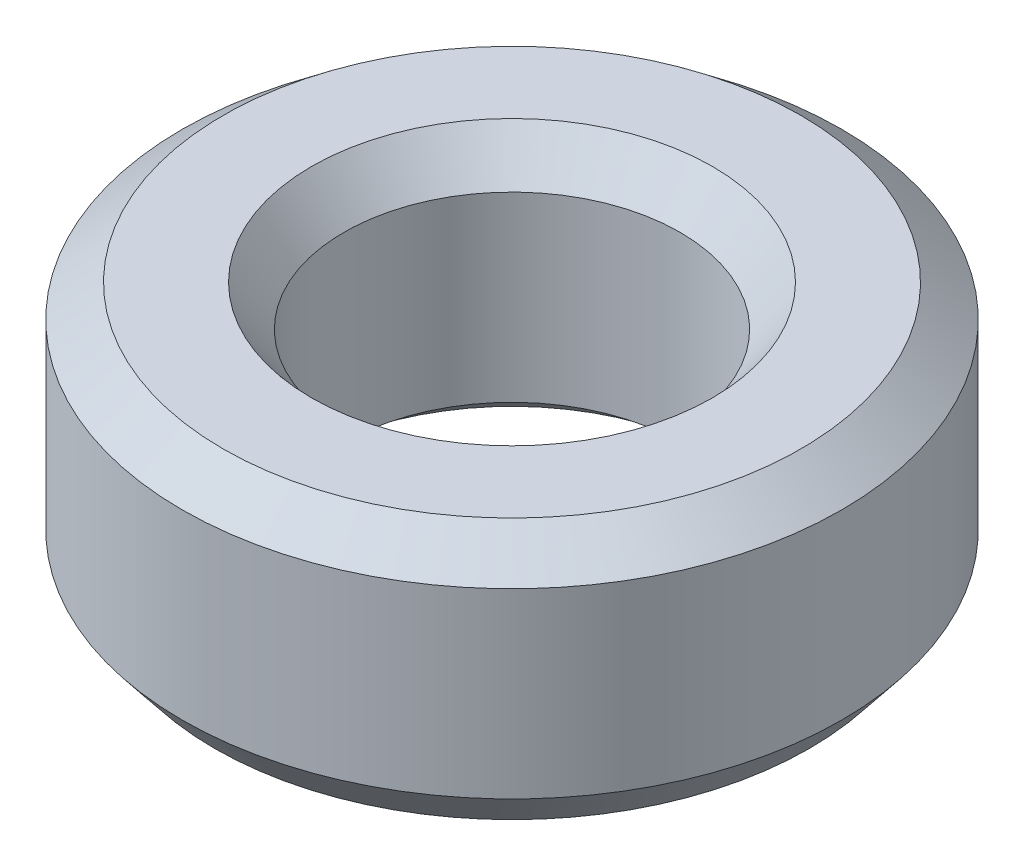
from build123d import *
from OCP.BRepFilletAPI import BRepFilletAPI_MakeChamfer

# Parameters (mm, degrees)
SKETCH1_R           = 35
BOSS_EXTRUDE1_DEPTH = 27.098370387
SKETCH2_R           = 17.840820631
CUT_EXTRUDE1_DEPTH  = 57.429794237
CHAMFER1_SIZE       = 3.438708375
CHAMFER1_SIZE2      = 4.333782867


with BuildPart() as part:
    # Sketch1 → Boss-Extrude1 (new body)
    with BuildSketch(Plane(origin=(0, 0, 0), x_dir=(1, 0, 0), z_dir=(0, 1, 0))):
        Circle(SKETCH1_R)
    extrude(amount=BOSS_EXTRUDE1_DEPTH)

    # Sketch2 → Cut-Extrude1 (cut, through all)
    with BuildSketch(Plane(origin=(0, 0, 0), x_dir=(1, 0, 0), z_dir=(0, 1, 0))):
        Circle(SKETCH2_R)
    extrude(amount=CUT_EXTRUDE1_DEPTH, mode=Mode.SUBTRACT)

    # Chamfer1: one chamfer whose edges measure the first distance from different faces: ONE call of the kernel's chamfer builder (chamfer() names one face for all edges)
    chamfer1_edges_1 = [part.edges().sort_by_distance(p)[0] for p in [
        (-17.840820631, 27.098370387, 0),
    ]]
    chamfer1_side_1 = [part.faces().sort_by_distance(p)[0] for p in [
        (-34.010050506, 27.098370387, 0),
    ]]
    chamfer1_edges_2 = [part.edges().sort_by_distance(p)[0] for p in [
        (-17.840820631, 0, 0),
    ]]
    chamfer1_side_2 = [part.faces().sort_by_distance(p)[0] for p in [
        (-17.840820631, 13.549185194, 0),
    ]]
    chamfer1_edges_3 = [part.edges().sort_by_distance(p)[0] for p in [
        (-35, 0, 0),
    ]]
    chamfer1_side_3 = [part.faces().sort_by_distance(p)[0] for p in [
        (-34.010050506, 0, 0),
    ]]
    chamfer1_edges_4 = [part.edges().sort_by_distance(p)[0] for p in [
        (-35, 27.098370387, 0),
    ]]
    chamfer1_side_4 = [part.faces().sort_by_distance(p)[0] for p in [
        (-35, 13.549185194, 0),
    ]]
    chamfer1 = BRepFilletAPI_MakeChamfer(part.part.solid().wrapped)
    for e in chamfer1_edges_1:
        chamfer1.Add(CHAMFER1_SIZE, CHAMFER1_SIZE2, e.wrapped, chamfer1_side_1[0].wrapped)  # the first distance lies on this face
    for e in chamfer1_edges_2:
        chamfer1.Add(CHAMFER1_SIZE, CHAMFER1_SIZE2, e.wrapped, chamfer1_side_2[0].wrapped)  # the first distance lies on this face
    for e in chamfer1_edges_3:
        chamfer1.Add(CHAMFER1_SIZE, CHAMFER1_SIZE2, e.wrapped, chamfer1_side_3[0].wrapped)  # the first distance lies on this face
    for e in chamfer1_edges_4:
        chamfer1.Add(CHAMFER1_SIZE, CHAMFER1_SIZE2, e.wrapped, chamfer1_side_4[0].wrapped)  # the first distance lies on this face
    add(Compound.cast(chamfer1.Shape()), mode=Mode.REPLACE)


solid = part.part
